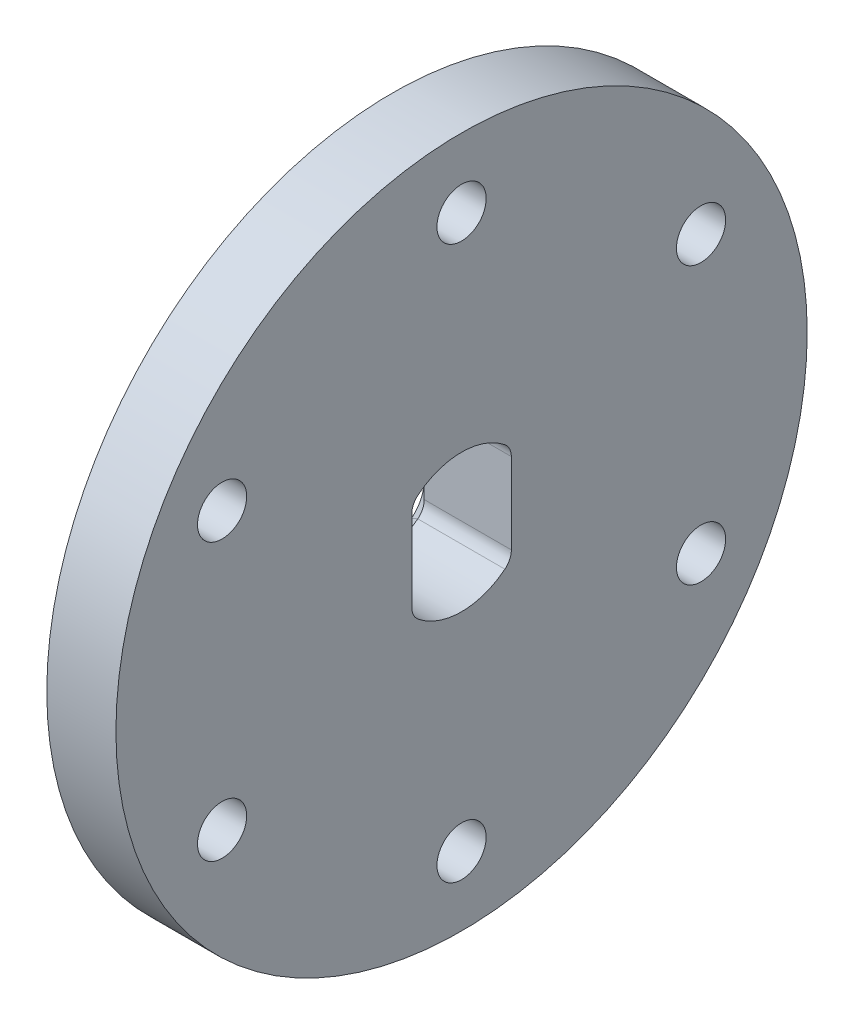
from build123d import *

# Parameters (mm, degrees)
SKETCH1_R           = 15.875
BOSS_EXTRUDE1_DEPTH = 3.175
SKETCH2_R           = 7.9375
BOSS_EXTRUDE2_DEPTH = 1.5875
CUT_EXTRUDE1_DEPTH  = 23.950221268
FILLET2_R           = 0.79375
CIRPATTERN1_COUNT   = 6
FILLET9_R           = 1.5875
CHAMFER1_SIZE       = 0.762


with BuildPart() as part:
    # Sketch1 → Boss-Extrude1 (new body)
    with BuildSketch(Plane(origin=(0, 0, 0), x_dir=(0, 0, -1), z_dir=(1, 0, 0))):
        Circle(SKETCH1_R)
    extrude(amount=BOSS_EXTRUDE1_DEPTH)

    # Sketch2 → Boss-Extrude2 (add)
    with BuildSketch(Plane.ZY):
        with Locations(Location((0, 0, 0), (0, 0, 180))):
            Circle(SKETCH2_R)
    extrude(amount=BOSS_EXTRUDE2_DEPTH)

    # Sketch3 → Cut-Extrude1 (cut, through all)
    with BuildSketch(Plane(origin=(3.175, 0, 0), x_dir=(0, 0, -1), z_dir=(1, 0, 0))):
        with BuildLine():
            Line((-2.286, 2.20336765), (-2.286, -2.20336765))
            ThreePointArc((-2.286, -2.20336765), (0, -3.175), (2.286, -2.20336765))
            Line((2.286, -2.20336765), (2.286, 2.20336765))
            ThreePointArc((2.286, 2.20336765), (0, 3.175), (-2.286, 2.20336765))
        make_face()
    extrude(amount=-CUT_EXTRUDE1_DEPTH, mode=Mode.SUBTRACT)

    # Fillet2
    fillet2_edges = [part.edges().sort_by_distance(p)[0] for p in [
        (0.79375, 2.20336765, 2.286),
        (0.79375, 2.20336765, -2.286),
        (0.79375, -2.20336765, -2.286),
        (0.79375, -2.20336765, 2.286),
    ]]
    fillet(fillet2_edges, radius=FILLET2_R)

    # Sketch5 → #4-40 Tapped Hole1 (revolve, cut)
    with BuildSketch(Plane(origin=(3.175, 12.7, 0), x_dir=(0, 0, -1), z_dir=(0, 1, 0))):
        Polygon((0, 0), (0, 8.299152758), (1.1303, 7.62), (1.1303, 0), align=None)
    f_4_40_tapped_hole1 = revolve(axis=Axis((9.525, 12.7, 0), (-1, 0, 0)), mode=Mode.SUBTRACT)

    # CirPattern1: #4-40 Tapped Hole1 ×6 about axis
    cirpattern1_axis = Axis((0, 0, 0), (1, 0, 0))
    for i in range(1, CIRPATTERN1_COUNT):
        add(f_4_40_tapped_hole1.rotate(cirpattern1_axis, i * 360 / CIRPATTERN1_COUNT), mode=Mode.SUBTRACT)

    # Fillet9
    fillet9_edges = [part.edges().sort_by_distance(p)[0] for p in [
        (0, 0, 7.9375),
    ]]
    fillet(fillet9_edges, radius=FILLET9_R - 0.0001)  # a hair under: the kernel refuses the full size

    # Chamfer1
    chamfer1_edges = [part.edges().sort_by_distance(p)[0] for p in [
        (-1.5875, 0, -2.286),
        (-1.5875, -3.175, 0),
        (-1.5875, 0, 2.286),
        (-1.5875, 3.175, 0),
        (-1.5875, -2.198617373, -2.208093398),
        (-1.5875, -2.198617373, 2.208093398),
        (-1.5875, 2.198617373, -2.208093398),
        (-1.5875, 2.198617373, 2.208093398),
    ]]
    chamfer(chamfer1_edges, length=CHAMFER1_SIZE)


solid = part.part
